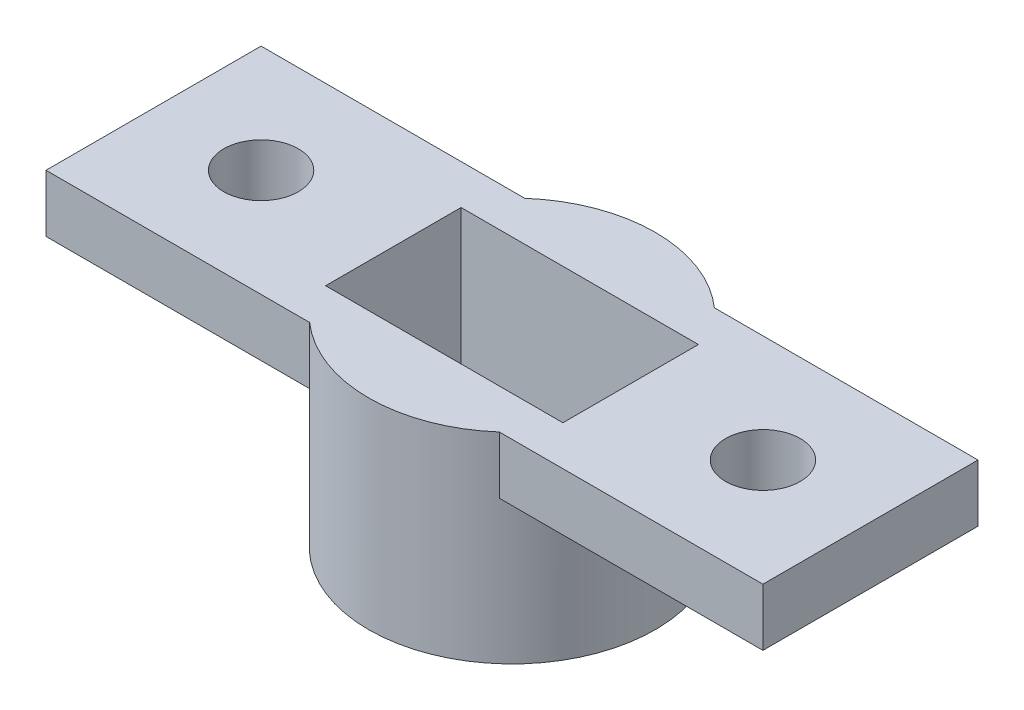
from build123d import *

# Parameters (mm, degrees)
SKETCH1_W           = 31.75
SKETCH1_H           = 9.525
SKETCH1_R           = 1.651
SKETCH1_W_2         = 10.51
SKETCH1_H_2         = 6
BOSS_EXTRUDE1_DEPTH = 2.54
SKETCH2_R           = 6.35
SKETCH2_W           = 10.51
SKETCH2_H           = 6
BOSS_EXTRUDE2_DEPTH = 8.89


with BuildPart() as part:
    # Sketch1 → Boss-Extrude1 (new body)
    with BuildSketch(Plane(origin=(0, 0, 0), x_dir=(1, 0, 0), z_dir=(0, 1, 0))):
        Rectangle(SKETCH1_W, SKETCH1_H)
        with Locations((11.1125, 0)):
            Circle(SKETCH1_R, mode=Mode.SUBTRACT)
        with Locations((-11.1125, 0)):
            Circle(SKETCH1_R, mode=Mode.SUBTRACT)
        Rectangle(SKETCH1_W_2, SKETCH1_H_2, mode=Mode.SUBTRACT)
    extrude(amount=BOSS_EXTRUDE1_DEPTH)

    # Sketch2 → Boss-Extrude2 (add)
    with BuildSketch(Plane(origin=(0, 2.54, 0), x_dir=(1, 0, 0), z_dir=(0, 1, 0))):
        Circle(SKETCH2_R)
        Rectangle(SKETCH2_W, SKETCH2_H, mode=Mode.SUBTRACT)
    extrude(amount=-BOSS_EXTRUDE2_DEPTH)


solid = part.part
